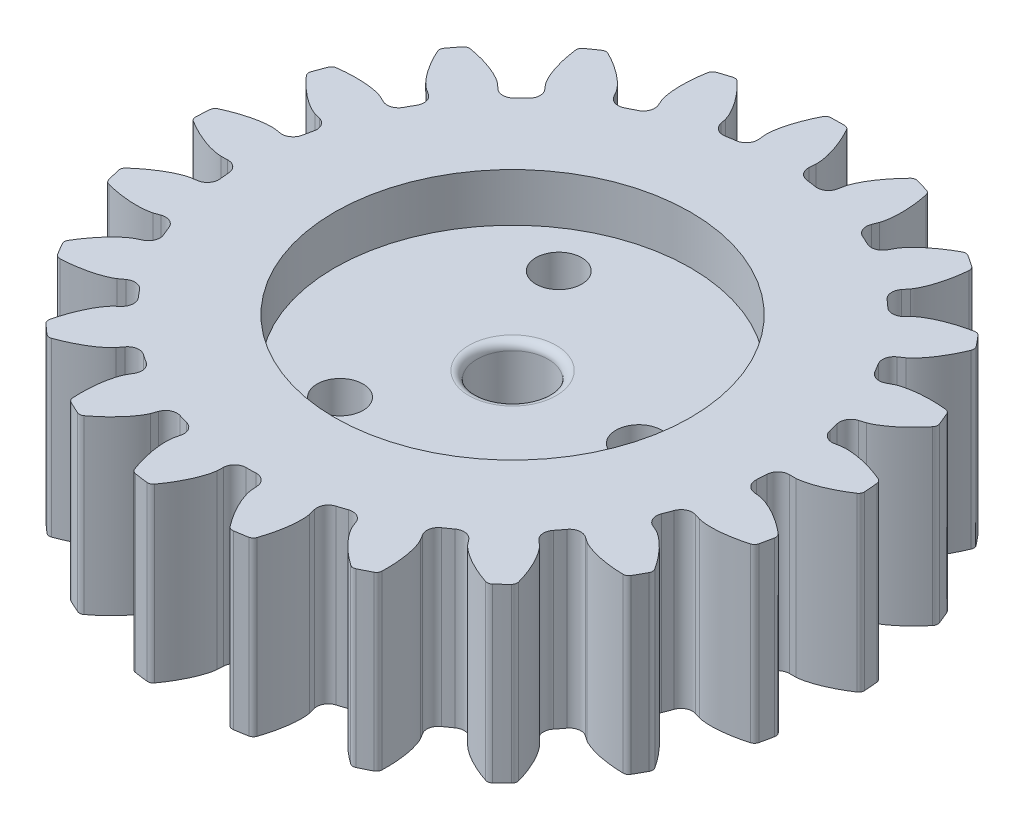
from build123d import *
from build123d.topology import SkipClean

# Parameters (mm, degrees)
SALIENTE_EXTRUIR4_DEPTH  = 15
REDONDEO5_R              = 1
REDONDEO6_R              = 0.5
REDONDEO5_OF_SIMETR_A1_R = 1
REDONDEO6_OF_SIMETR_A1_R = 0.5
MATRIZC8_COUNT           = 21
CROQUIS11_R              = 3.1
CORTAR_EXTRUIR5_DEPTH    = 44.322694066
CROQUIS12_R              = 6.5
CROQUIS12_R_2            = 3.1
SALIENTE_EXTRUIR7_DEPTH  = 2
CROQUIS13_R              = 2
CORTAR_EXTRUIR6_DEPTH    = 12
CROQUIS14_R              = 15.5
CORTAR_EXTRUIR7_DEPTH    = 4.2
REDONDEO7_R              = 0.7


with BuildPart() as part:
    # Croquis1 → Saliente-Extruir4 (new body)
    with BuildSketch(Plane(origin=(0, 0, 0), x_dir=(1, 0, 0), z_dir=(0, 1, 0))):
        with BuildLine():
            Line((23.032008424, 2.071765659), (0, 0))
            Line((0, 0), (23.125, 0))
            ThreePointArc((23.125, 0), (23.101740409, 1.036925791), (23.032008424, 2.071765659))
        make_face()
        with BuildLine():
            Line((23.125, 0), (0, 0))
            Line((0, 0), (23.083540569, -1.384116982))
            ThreePointArc((23.083540569, -1.384116982), (23.114632818, -0.692368887), (23.125, 0))
        make_face()
        with BuildLine():
            ThreePointArc((23.032008424, 2.071765659), (23.101740409, 1.036925791), (23.125, 0))
            Line((23.125, 0), (24.666931296, 0))
            ThreePointArc((24.666931296, 0), (24.642120799, 1.106066043), (24.567739217, 2.209907078))
            Line((24.567739217, 2.209907078), (23.032008424, 2.071765659))
        make_face()
        with BuildLine():
            ThreePointArc((24.567739217, 2.209907078), (24.642120799, 1.106066043), (24.666931296, 0))
            add(Edge.make_bspline(
                [(24.666931296, 0), (24.673468216, 8.28e-05), (24.691799913, 0.000571479), (24.726442255, 0.002508053), (24.782925901, 0.007105902), (24.854811864, 0.015076924), (24.947595065, 0.027803625), (25.056693297, 0.045910863), (25.176335321, 0.069069821), (25.306182072, 0.097778424), (25.435406359, 0.129521363), (25.56398614, 0.16406881), (25.691754464, 0.201080161), (25.846112081, 0.248974942), (26.030607504, 0.310658511), (26.245295064, 0.388933984), (26.487579555, 0.48498528), (26.733095032, 0.590623582), (26.973478478, 0.700926556), (27.214847692, 0.819641644), (27.447309666, 0.939653094), (27.687079376, 1.071704096), (27.90755034, 1.197359969), (28.152555337, 1.346273077), (28.34970282, 1.468826758), (28.551596884, 1.602169292), (28.649596378, 1.668061286), (28.699567455, 1.702153907)],
                knots=[0, 0, 0, 0, 0, 0.005376749, 0.015083688, 0.02853182, 0.04661014, 0.064854849, 0.092110526, 0.119476176, 0.146842496, 0.174208854, 0.201574956, 0.228941013, 0.256307345, 0.307035032, 0.361767352, 0.416499661, 0.471231937, 0.525964282, 0.580696616, 0.635428982, 0.690161387, 0.744893688, 0.799626082, 0.854358407, 0.909090915, 0.909090915, 0.909090915, 0.909090915, 0.909090915], degree=4))
            ThreePointArc((28.699567455, 1.702153907), (28.670305386, 2.139179537), (28.634388852, 2.575708657))
            Line((28.634388852, 2.575708657), (24.567739217, 2.209907078))
        make_face()
    saliente_extruir4 = extrude(amount=SALIENTE_EXTRUIR4_DEPTH)

    # Redondeo5
    redondeo5_edges = [part.edges().sort_by_distance(p)[0] for p in [
        (23.125, 7.5, 0),
    ]]
    fillet(redondeo5_edges, radius=REDONDEO5_R)

    # Redondeo6
    redondeo6_edges = [part.edges().sort_by_distance(p)[0] for p in [
        (28.699567455, 7.5, -1.702153907),
    ]]
    fillet(redondeo6_edges, radius=REDONDEO6_R)

    # Simetría1: Saliente-Extruir4 across plane
    add(saliente_extruir4.mirror(Plane(origin=(0, 15, 0), x_dir=(0.9959787426686798, 0, -0.089589866347236), z_dir=(-0.089589866347236, 0, -0.9959787426686799))))

    # Redondeo5 of Simetría1
    redondeo5_of_simetr_a1_edges = [part.edges().sort_by_distance(p)[0] for p in [
        (22.753781583, 7.5, -4.126869113),
    ]]
    fillet(redondeo5_of_simetr_a1_edges, radius=REDONDEO5_OF_SIMETR_A1_R)

    # Redondeo6 of Simetría1
    redondeo6_of_simetr_a1_edges = [part.edges().sort_by_distance(p)[0] for p in [
        (28.542627277, 7.5, -3.446872227),
    ]]
    fillet(redondeo6_of_simetr_a1_edges, radius=REDONDEO6_OF_SIMETR_A1_R)


with BuildPart() as matrizc8_1:
    # MatrizC8: pattern copy
    add(part.part.rotate(Axis((0, 15, 0), (0, -1, 0)), 1 * 360 / MATRIZC8_COUNT))


with BuildPart() as matrizc8_2:
    # MatrizC8: pattern copy
    add(part.part.rotate(Axis((0, 15, 0), (0, -1, 0)), 2 * 360 / MATRIZC8_COUNT))


with BuildPart() as matrizc8_3:
    # MatrizC8: pattern copy
    add(part.part.rotate(Axis((0, 15, 0), (0, -1, 0)), 3 * 360 / MATRIZC8_COUNT))


with BuildPart() as matrizc8_4:
    # MatrizC8: pattern copy
    add(part.part.rotate(Axis((0, 15, 0), (0, -1, 0)), 4 * 360 / MATRIZC8_COUNT))


with BuildPart() as matrizc8_5:
    # MatrizC8: pattern copy
    add(part.part.rotate(Axis((0, 15, 0), (0, -1, 0)), 5 * 360 / MATRIZC8_COUNT))


with BuildPart() as matrizc8_6:
    # MatrizC8: pattern copy
    add(part.part.rotate(Axis((0, 15, 0), (0, -1, 0)), 6 * 360 / MATRIZC8_COUNT))


with BuildPart() as matrizc8_7:
    # MatrizC8: pattern copy
    add(part.part.rotate(Axis((0, 15, 0), (0, -1, 0)), 7 * 360 / MATRIZC8_COUNT))


with BuildPart() as matrizc8_8:
    # MatrizC8: pattern copy
    add(part.part.rotate(Axis((0, 15, 0), (0, -1, 0)), 8 * 360 / MATRIZC8_COUNT))


with BuildPart() as matrizc8_9:
    # MatrizC8: pattern copy
    add(part.part.rotate(Axis((0, 15, 0), (0, -1, 0)), 9 * 360 / MATRIZC8_COUNT))


with BuildPart() as matrizc8_10:
    # MatrizC8: pattern copy
    add(part.part.rotate(Axis((0, 15, 0), (0, -1, 0)), 10 * 360 / MATRIZC8_COUNT))


with BuildPart() as matrizc8_11:
    # MatrizC8: pattern copy
    add(part.part.rotate(Axis((0, 15, 0), (0, -1, 0)), 11 * 360 / MATRIZC8_COUNT))


with BuildPart() as matrizc8_12:
    # MatrizC8: pattern copy
    add(part.part.rotate(Axis((0, 15, 0), (0, -1, 0)), 12 * 360 / MATRIZC8_COUNT))


with BuildPart() as matrizc8_13:
    # MatrizC8: pattern copy
    add(part.part.rotate(Axis((0, 15, 0), (0, -1, 0)), 13 * 360 / MATRIZC8_COUNT))


with BuildPart() as matrizc8_14:
    # MatrizC8: pattern copy
    add(part.part.rotate(Axis((0, 15, 0), (0, -1, 0)), 14 * 360 / MATRIZC8_COUNT))


with BuildPart() as matrizc8_15:
    # MatrizC8: pattern copy
    add(part.part.rotate(Axis((0, 15, 0), (0, -1, 0)), 15 * 360 / MATRIZC8_COUNT))


with BuildPart() as matrizc8_16:
    # MatrizC8: pattern copy
    add(part.part.rotate(Axis((0, 15, 0), (0, -1, 0)), 16 * 360 / MATRIZC8_COUNT))


with BuildPart() as matrizc8_17:
    # MatrizC8: pattern copy
    add(part.part.rotate(Axis((0, 15, 0), (0, -1, 0)), 17 * 360 / MATRIZC8_COUNT))


with BuildPart() as matrizc8_18:
    # MatrizC8: pattern copy
    add(part.part.rotate(Axis((0, 15, 0), (0, -1, 0)), 18 * 360 / MATRIZC8_COUNT))


with BuildPart() as matrizc8_19:
    # MatrizC8: pattern copy
    add(part.part.rotate(Axis((0, 15, 0), (0, -1, 0)), 19 * 360 / MATRIZC8_COUNT))


with BuildPart() as matrizc8_20:
    # MatrizC8: pattern copy
    add(part.part.rotate(Axis((0, 15, 0), (0, -1, 0)), 20 * 360 / MATRIZC8_COUNT))


with BuildPart() as matrizc8_8_1:
    add(matrizc8_8.part)

    # Saliente-Extruir6: read off the stored shape, not the designer's step
    # Saliente-Extruir6: union part, MatrizC8_1, MatrizC8_20, MatrizC8_19, MatrizC8_18, MatrizC8_17, MatrizC8_16, MatrizC8_15, MatrizC8_14, MatrizC8_13, MatrizC8_12, MatrizC8_11, MatrizC8_10, MatrizC8_9, MatrizC8_7, MatrizC8_6, MatrizC8_5, MatrizC8_4, MatrizC8_3, MatrizC8_2
    add(part.part)
    add(matrizc8_1.part)
    add(matrizc8_20.part)
    add(matrizc8_19.part)
    add(matrizc8_18.part)
    add(matrizc8_17.part)
    add(matrizc8_16.part)
    add(matrizc8_15.part)
    add(matrizc8_14.part)
    add(matrizc8_13.part)
    add(matrizc8_12.part)
    add(matrizc8_11.part)
    add(matrizc8_10.part)
    add(matrizc8_9.part)
    add(matrizc8_7.part)
    add(matrizc8_6.part)
    add(matrizc8_5.part)
    add(matrizc8_4.part)
    add(matrizc8_3.part)
    add(matrizc8_2.part)

    # Croquis11 → Cortar-Extruir5 (cut, through all)
    with BuildSketch(Plane.XZ):
        with Locations(Location((0, 0, 0), (0, 0, 270))):
            Circle(CROQUIS11_R)
    extrude(amount=-CORTAR_EXTRUIR5_DEPTH, mode=Mode.SUBTRACT)

    # Croquis12 → Saliente-Extruir7 (add)
    with SkipClean():  # the faces are left unmerged after this step: merging them gives an invalid solid
        with BuildSketch(Plane.XZ):
            with Locations(Location((0, 0, 0), (0, 0, 90))):
                Circle(CROQUIS12_R)
            with Locations(Location((0, 0, 0), (0, 0, 270))):
                Circle(CROQUIS12_R_2, mode=Mode.SUBTRACT)
        extrude(amount=SALIENTE_EXTRUIR7_DEPTH)

    # Croquis13 → Cortar-Extruir6 (cut)
    with SkipClean():  # the faces are left unmerged after this step: merging them gives an invalid solid
        with BuildSketch(Plane(origin=(0, 15, 0), x_dir=(1, 0, 0), z_dir=(0, 1, 0))):
            with Locations(Location((11, 0, 0), (0, 0, 270))):
                Circle(CROQUIS13_R)
            with Locations(Location((-5.5, -9.526279442, 0), (0, 0, 270))):
                Circle(CROQUIS13_R)
            with Locations(Location((-5.5, 9.526279442, 0), (0, 0, 270))):
                Circle(CROQUIS13_R)
        extrude(amount=-CORTAR_EXTRUIR6_DEPTH, mode=Mode.SUBTRACT)

    # Croquis14 → Cortar-Extruir7 (cut)
    with SkipClean():  # the faces are left unmerged after this step: merging them gives an invalid solid
        with BuildSketch(Plane(origin=(0, 15, 0), x_dir=(1, 0, 0), z_dir=(0, 1, 0))):
            with Locations(Location((0, 0, 0), (0, 0, 270))):
                Circle(CROQUIS14_R)
        extrude(amount=-CORTAR_EXTRUIR7_DEPTH, mode=Mode.SUBTRACT)

    # Redondeo7
    redondeo7_edges = [matrizc8_8_1.edges().sort_by_distance(p)[0] for p in [
        (0, 10.8, 3.1),
    ]]
    fillet(redondeo7_edges, radius=REDONDEO7_R)


solid = matrizc8_8_1.part
